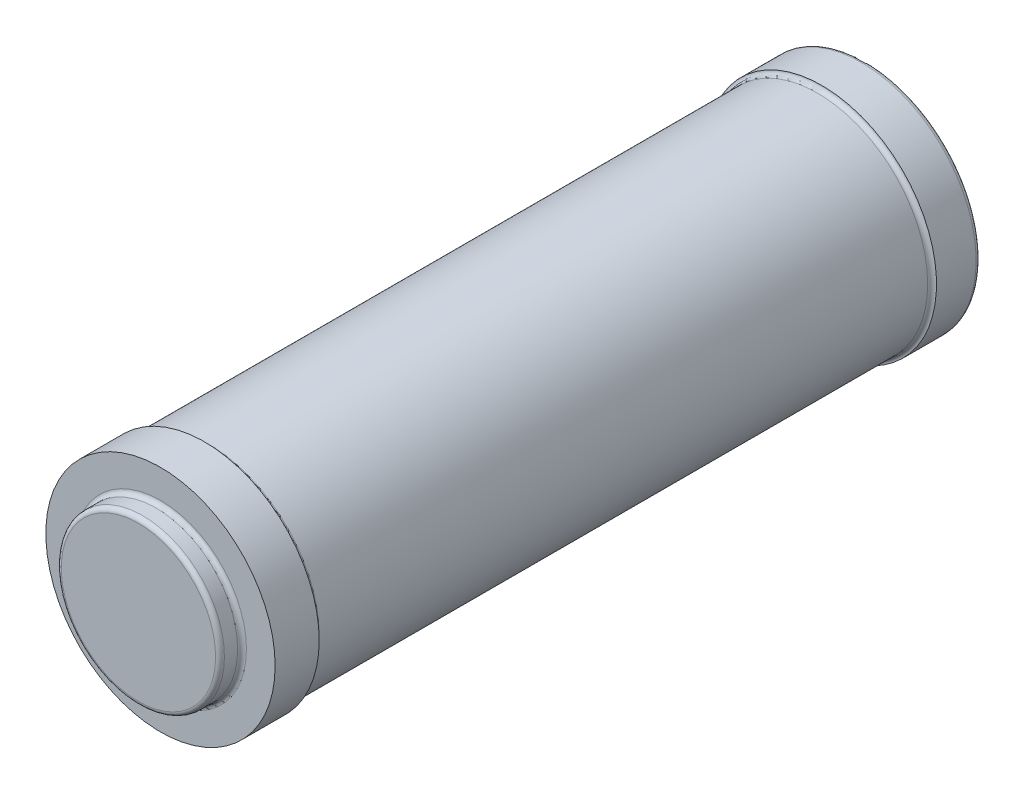
from build123d import *

# Parameters (mm, degrees)
ESBO_O1_R                     = 5
RESSALTO_EXTRUS_O1_DEPTH      = 30
ESBO_O2_R                     = 4.8
CORTE_EXTRUS_O1_DEPTH         = 30
RESSALTO_EXTRUS_O2_DEPTH      = 1
RESSALTO_EXTRUS_O2_DEPTH_BACK = 1
ESBO_O3_R                     = 5.2
ESBO_O4_R                     = 3.7
RESSALTO_EXTRUS_O3_DEPTH      = 1
RESSALTO_EXTRUS_O6_DEPTH      = 1
RESSALTO_EXTRUS_O6_DEPTH_BACK = 1
ESBO_O7_R                     = 5.2
FILETE1_R                     = 0.2


with BuildPart() as part:
    # Esboço1 → Ressalto-extrusão1 (new body)
    with BuildSketch(Plane.XY):
        with Locations((-12.745849563, -1.537898167)):
            Circle(ESBO_O1_R)
    extrude(amount=RESSALTO_EXTRUS_O1_DEPTH)

    # Esboço2 → Corte-extrusão1 (cut)
    with BuildSketch(Plane.XY.offset(30)):
        with Locations((-12.745849563, -1.537898167)):
            Circle(ESBO_O2_R)
    extrude(amount=-CORTE_EXTRUS_O1_DEPTH, mode=Mode.SUBTRACT)

    # Esboço3 → Ressalto-extrusão2 (add, two sides: drawn at the far end of the back side and taken through both)
    with BuildSketch(Plane.XY.offset(30).offset(-RESSALTO_EXTRUS_O2_DEPTH_BACK)):
        with Locations((-12.745849563, -1.537898167)):
            Circle(ESBO_O3_R)
    extrude(amount=RESSALTO_EXTRUS_O2_DEPTH + RESSALTO_EXTRUS_O2_DEPTH_BACK)

    # Esboço4 → Ressalto-extrusão3 (add)
    with BuildSketch(Plane.XY.offset(31)):
        with Locations((-12.745849563, -1.537898167)):
            Circle(ESBO_O4_R)
    extrude(amount=RESSALTO_EXTRUS_O3_DEPTH)

    # Esboço7 → Ressalto-extrusão6 (add, two sides: drawn at the far end of the back side and taken through both)
    with BuildSketch(Plane(origin=(0, 0, 0), x_dir=(-1, 0, 0), z_dir=(0, 0, -1)).offset(-RESSALTO_EXTRUS_O6_DEPTH_BACK)):
        with Locations(Location((12.745849563, -1.537898167, 0), (0, 0, 180))):
            Circle(ESBO_O7_R)
    extrude(amount=RESSALTO_EXTRUS_O6_DEPTH + RESSALTO_EXTRUS_O6_DEPTH_BACK)

    # Filete1
    filete1_edges = [part.edges().sort_by_distance(p)[0] for p in [
        (-17.745849563, -1.537898167, 29),
        (-16.445849563, -1.537898167, 31),
        (-16.445849563, -1.537898167, 32),
        (-17.745849563, -1.537898167, 1),
        (-17.945849563, -1.537898167, -1),
    ]]
    fillet(filete1_edges, radius=FILETE1_R - 0.0001)  # a hair under: the kernel refuses the full size


solid = part.part
